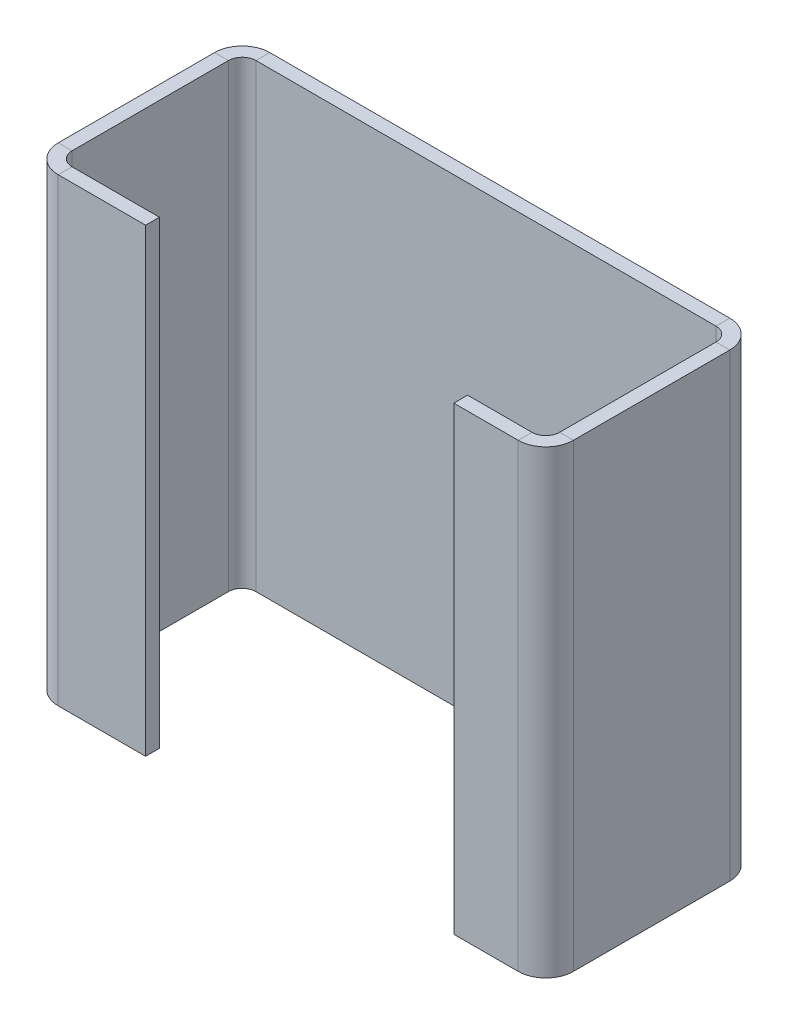
from build123d import *

# Parameters (mm, degrees)
SKETCH1_W          = 100
SKETCH1_H          = 100
BASE_FLANGE1_DEPTH = 3
EDGE_FLANGE1_DEPTH = 100
EDGE_FLANGE2_DEPTH = 100
EDGE_FLANGE6_DEPTH = 100
EDGE_FLANGE7_DEPTH = 100


# Sheet-metal steps are written as plain solids
with BuildPart() as part:
    # Sketch1 → Base-Flange1 (new body)
    with BuildSketch(Plane.XY):
        Rectangle(SKETCH1_W, SKETCH1_H)
    extrude(amount=-BASE_FLANGE1_DEPTH)

    # Edge-Flange1 section (across the edge) → Edge-Flange1 (add)
    with BuildSketch(Plane(origin=(-53, 50, 0), x_dir=(1, 0, 0), z_dir=(0, -1, 0))):
        with BuildLine():
            Line((-3, 3), (-3, 37))
            Line((-3, 37), (0, 37))
            Line((0, 37), (0, 3))
            ThreePointArc((0, 3), (0.878679656, 0.878679656), (3, 0))
            Line((3, 0), (3, -3))
            ThreePointArc((3, -3), (-1.242640687, -1.242640687), (-3, 3))
        make_face()
    extrude(amount=EDGE_FLANGE1_DEPTH)

    # Edge-Flange2 section (across the edge) → Edge-Flange2 (add)
    with BuildSketch(Plane(origin=(53, -50, 0), x_dir=(-1, 0, 0), z_dir=(0, 1, 0))):
        with BuildLine():
            Line((-3, 3), (-3, 37))
            Line((-3, 37), (0, 37))
            Line((0, 37), (0, 3))
            ThreePointArc((0, 3), (0.878679656, 0.878679656), (3, 0))
            Line((3, 0), (3, -3))
            ThreePointArc((3, -3), (-1.242640687, -1.242640687), (-3, 3))
        make_face()
    extrude(amount=EDGE_FLANGE2_DEPTH)

    # Edge-Flange6 section (across the edge) → Edge-Flange6 (add)
    with BuildSketch(Plane(origin=(-53, 50, 40), x_dir=(0, 0, -1), z_dir=(0, -1, 0))):
        with BuildLine():
            Line((-3, 3), (-3, 22))
            Line((-3, 22), (0, 22))
            Line((0, 22), (0, 3))
            ThreePointArc((0, 3), (0.878679656, 0.878679656), (3, 0))
            Line((3, 0), (3, -3))
            ThreePointArc((3, -3), (-1.242640687, -1.242640687), (-3, 3))
        make_face()
    extrude(amount=EDGE_FLANGE6_DEPTH)

    # Edge-Flange7 section (across the edge) → Edge-Flange7 (add)
    with BuildSketch(Plane(origin=(53, -50, 40), x_dir=(0, 0, -1), z_dir=(0, 1, 0))):
        with BuildLine():
            Line((-3, 3), (-3, 17))
            Line((-3, 17), (0, 17))
            Line((0, 17), (0, 3))
            ThreePointArc((0, 3), (0.878679656, 0.878679656), (3, 0))
            Line((3, 0), (3, -3))
            ThreePointArc((3, -3), (-1.242640687, -1.242640687), (-3, 3))
        make_face()
    extrude(amount=EDGE_FLANGE7_DEPTH)


solid = part.part
